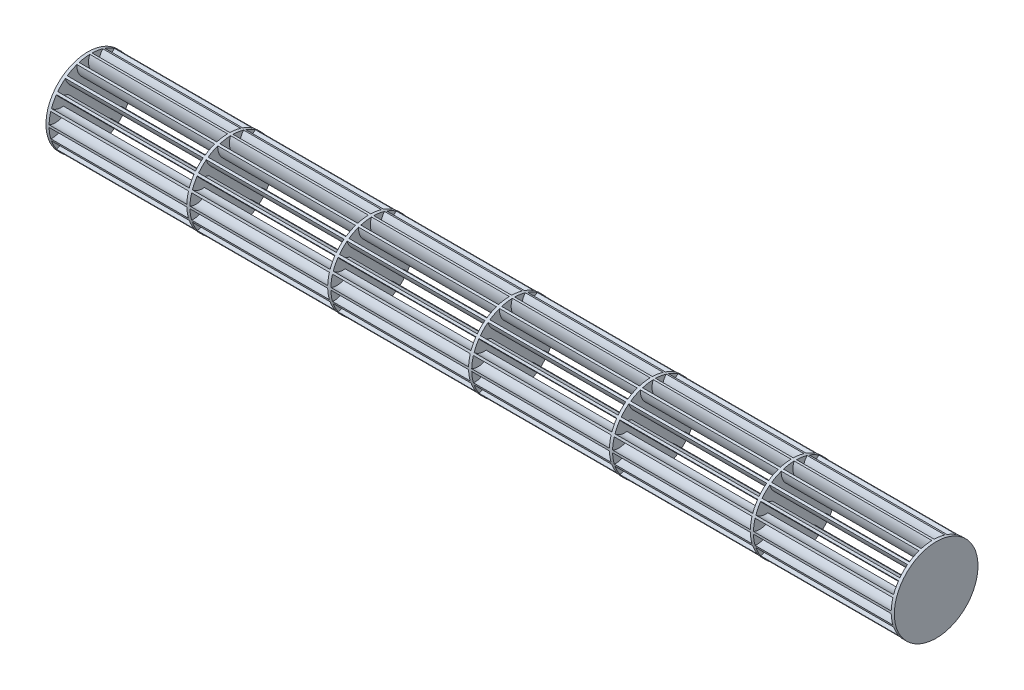
from build123d import *
from build123d.topology import SkipClean

# Parameters (mm, degrees)
SKETCH2_R           = 20
BOSS_EXTRUDE2_DEPTH = 1.5
BOSS_EXTRUDE1_DEPTH = 202
CIRPATTERN1_COUNT   = 20
LPATTERN1_COUNT     = 7
LPATTERN1_PITCH     = 67.333333333


with BuildPart() as part:
    # Sketch2 → Boss-Extrude2 (new body)
    with BuildSketch(Plane(origin=(202, 0, 0), x_dir=(0, 0, -1), z_dir=(1, 0, 0))):
        Circle(SKETCH2_R)
    boss_extrude2 = extrude(amount=-BOSS_EXTRUDE2_DEPTH)

    # Sketch1 → Boss-Extrude1 (add, symmetric)
    with BuildSketch(Plane(origin=(0, 0, 0), x_dir=(0, 0, -1), z_dir=(1, 0, 0))):
        with BuildLine():
            ThreePointArc((0.545877383, 19.992549059), (0, 20), (-0.545877383, 19.992549059))
            ThreePointArc((-0.545877383, 19.992549059), (-1.130325382, 16.990951396), (-0.545877383, 13.989353734))
            ThreePointArc((-0.545877383, 13.989353734), (0, 14), (0.545877383, 13.989353734))
            ThreePointArc((0.545877383, 13.989353734), (-0.130325382, 16.990951396), (0.545877383, 19.992549059))
        make_face()
    boss_extrude1 = extrude(amount=BOSS_EXTRUDE1_DEPTH, both=True)

    # CirPattern1: Boss-Extrude1 ×20 about axis
    cirpattern1_axis = Axis((202, 0, 0), (1, 0, 0))
    for i in range(1, CIRPATTERN1_COUNT):
        add(boss_extrude1.rotate(cirpattern1_axis, i * 360 / CIRPATTERN1_COUNT))

    # LPattern1: Boss-Extrude2 ×7
    with SkipClean():  # the faces are left unmerged after this step: merging them gives an invalid solid
        with Locations(*[(-i * LPATTERN1_PITCH, 0, 0) for i in range(1, LPATTERN1_COUNT)]):
            add(boss_extrude2)


solid = part.part
